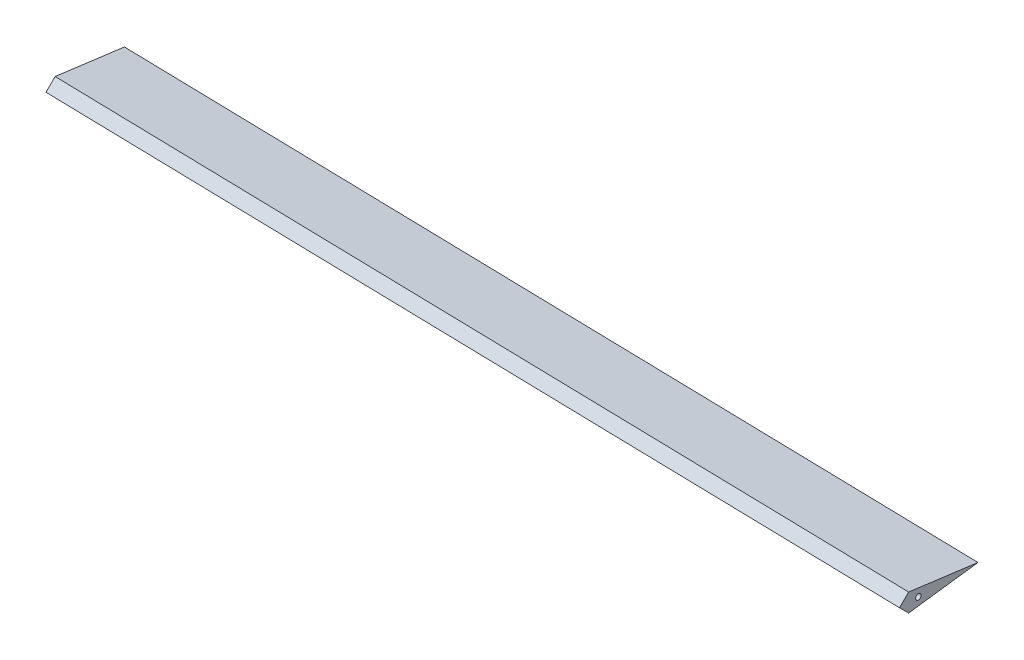
from build123d import *

# Parameters (mm, degrees)
AILERON_DEPTH           = 439.699303134
CUT_EXTRUDE2_DEPTH      = 449.810803704
CUT_EXTRUDE2_DEPTH_BACK = 449.810803704
SKETCH2_R               = 2.75


with BuildPart() as part:
    # aileron_root → aileron (new, symmetric, along a direction that is not the sketch's normal)
    with BuildSketch(Plane(origin=(0, 0, 0), x_dir=(0, 0, -1), z_dir=(1, 0, 0))):
        Polygon((-80, -10.4921175), (-80, 10.4921175), (0, 0), align=None)
    extrude(amount=AILERON_DEPTH, dir=(0.9997459918385792, 0, 0.02253778610901217), both=True)

    # Sketch2 → Cut-Extrude2 (cut, two sides: drawn at the far end of the back side and taken through both)
    with BuildSketch(Plane(origin=(0, 0, 0), x_dir=(-0.02253778610901217, 0, 0.9997459918385792), z_dir=(-0.9997459918385792, 0, -0.02253778610901217)).offset(-CUT_EXTRUDE2_DEPTH_BACK)):
        with Locations((60, 0)):
            Circle(SKETCH2_R)
        Polygon((78.979679347, 0), (68.487561847, -10.4921175), (79.979679347, -10.4921175), (79.979679347, 10.4921175), (68.487561847, 10.4921175), align=None)
    extrude(amount=CUT_EXTRUDE2_DEPTH + CUT_EXTRUDE2_DEPTH_BACK, mode=Mode.SUBTRACT)


solid = part.part
